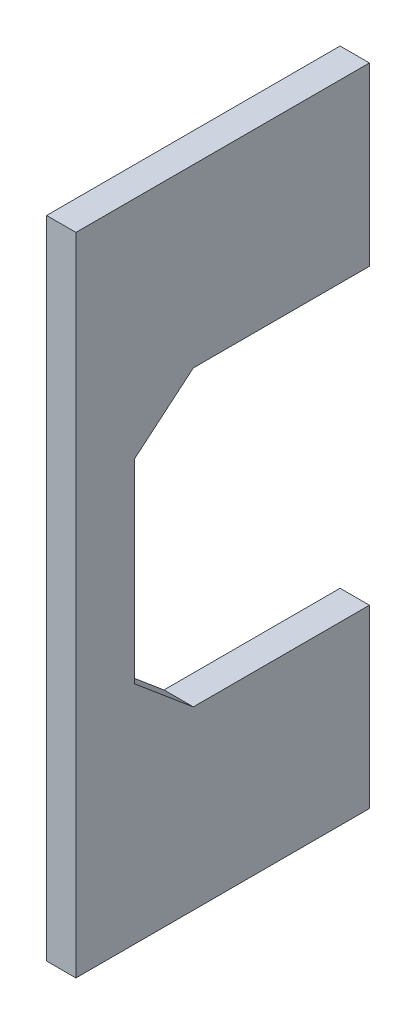
from build123d import *

# Parameters (mm, degrees)
SKIZZE1_W                       = 50
SKIZZE1_H                       = 110
AUFSATZ_LINEAR_AUSTRAGEN1_DEPTH = 5
SCHNITT_LINEAR_AUSTRAGEN1_DEPTH = 121.933866224


with BuildPart() as part:
    # Skizze1 → Aufsatz-Linear austragen1 (new body)
    with BuildSketch(Plane(origin=(0, 0, 0), x_dir=(0, 0, -1), z_dir=(1, 0, 0))):
        with Locations((25, 55)):
            Rectangle(SKIZZE1_W, SKIZZE1_H)
    extrude(amount=AUFSATZ_LINEAR_AUSTRAGEN1_DEPTH)

    # Skizze2 → Schnitt-Linear austragen1 (cut, through all)
    with BuildSketch(Plane(origin=(5, 0, 0), x_dir=(0, 0, -1), z_dir=(1, 0, 0))):
        Polygon((10, 38.390996312), (10, 71.609003688), (20, 80), (50, 80), (50, 30), (20, 30), align=None)
    extrude(amount=-SCHNITT_LINEAR_AUSTRAGEN1_DEPTH, mode=Mode.SUBTRACT)


solid = part.part
